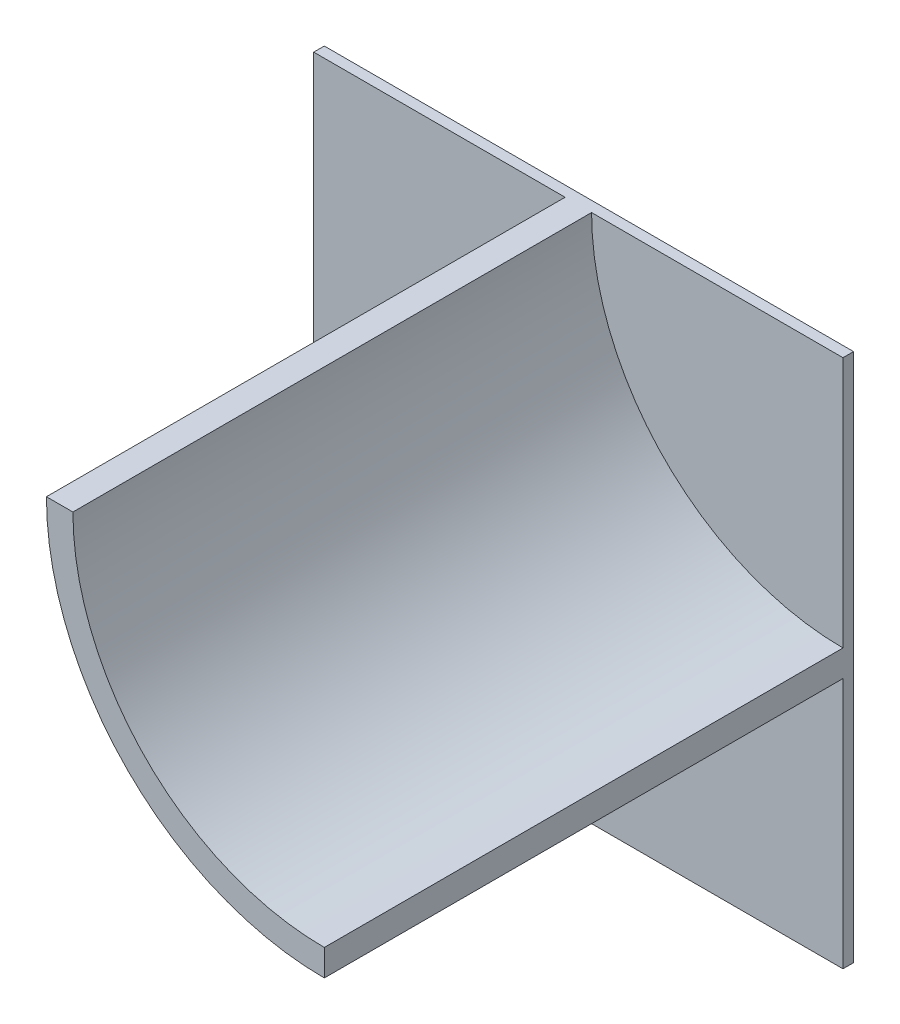
from build123d import *

# Parameters (mm, degrees)
SZKIC1_W                    = 200
SZKIC1_H                    = 200
DODANIE_WYCI_GNI_CIE1_DEPTH = 4
DODANIE_WYCI_GNI_CIE5_DEPTH = 196


with BuildPart() as part:
    # Szkic1 → Dodanie-wyciągnięcie1 (new body)
    with BuildSketch(Plane.XY):
        Rectangle(SZKIC1_W, SZKIC1_H)
    extrude(amount=DODANIE_WYCI_GNI_CIE1_DEPTH)

    # Szkic2 → Dodanie-wyciągnięcie5 (add)
    with BuildSketch(Plane.XY.offset(4)):
        with BuildLine():
            ThreePointArc((-5, 100), (25.753787975, 25.753787975), (100, -5))
            Line((100, -5), (100, 5))
            ThreePointArc((100, 5), (32.824855787, 32.824855787), (5, 100))
            Line((5, 100), (-5, 100))
        make_face()
    extrude(amount=DODANIE_WYCI_GNI_CIE5_DEPTH)


solid = part.part
